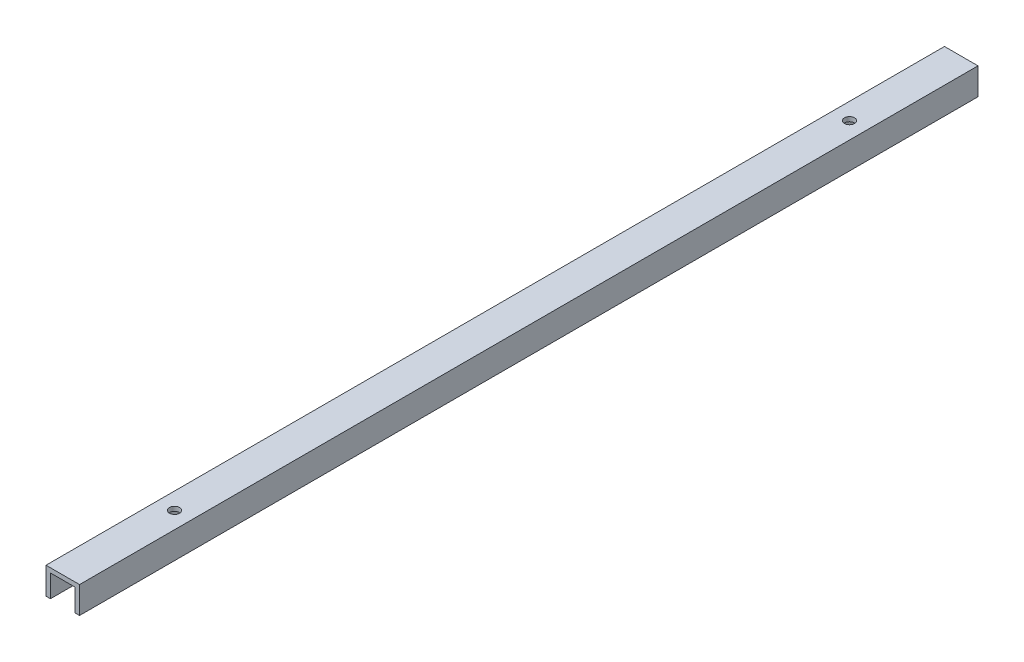
from build123d import *

# Parameters (mm, degrees)
SM_BASE_FLANGE_2_DEPTH = 402
SKETCH_7_R             = 2.25
CUT_EXTRUDE_1_DEPTH    = 403.389115161


# Sheet-metal steps are written as plain solids
with BuildPart() as part:
    # Эскиз6 → Базовая кромка2 (new body)
    with BuildSketch(Plane.XY):
        Polygon((0, 0), (-2, 0), (-2, 12), (13, 12), (13, 0), (11, 0), (11, 10), (0, 10), align=None)
    extrude(amount=-SM_BASE_FLANGE_2_DEPTH)

    # Эскиз7 → Вырез-Вытянуть1 (cut, through all)
    with BuildSketch(Plane(origin=(0, 12, 0), x_dir=(1, 0, 0), z_dir=(0, 1, 0))):
        with Locations(Location((5.5, 50, 0), (0, 0, 270))):
            Circle(SKETCH_7_R)
        with Locations(Location((5.5, 352, 0), (0, 0, 270))):
            Circle(SKETCH_7_R)
    extrude(amount=-CUT_EXTRUDE_1_DEPTH, mode=Mode.SUBTRACT)


solid = part.part
